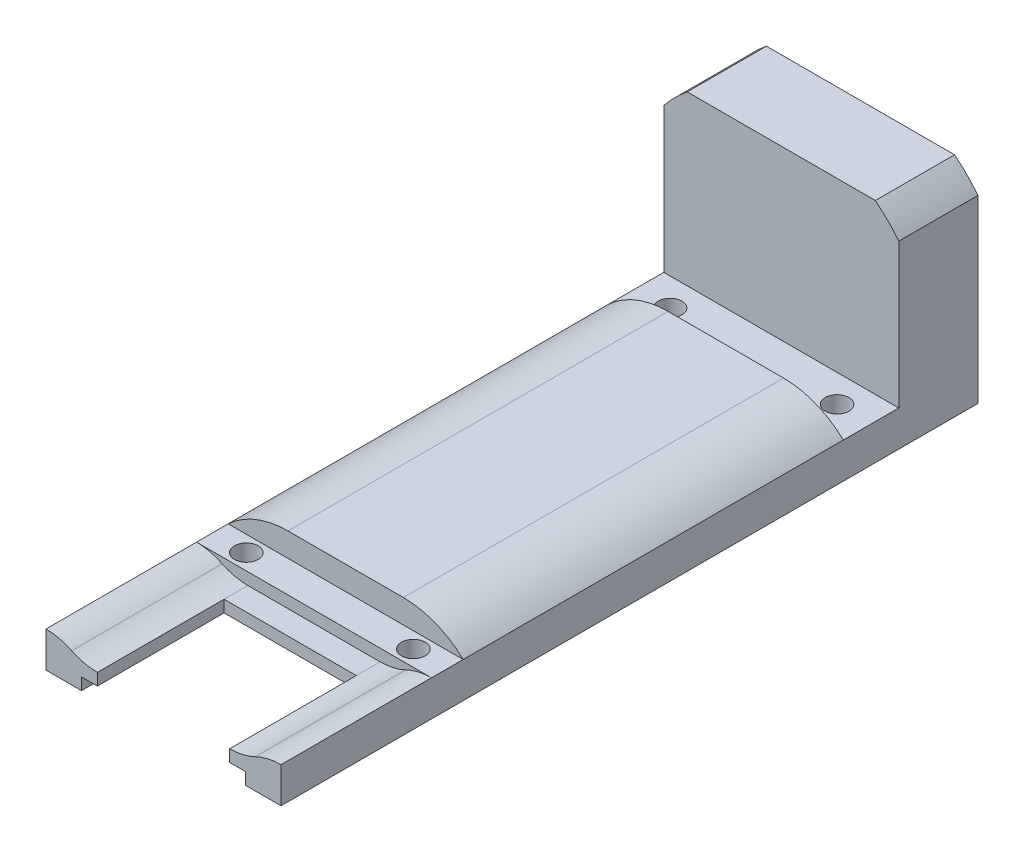
from build123d import *

# Parameters (mm, degrees)
SKETCH1_W               = 6.485
SKETCH1_H               = 4.5
BOSS_EXTRUDE1_DEPTH     = 88
BOSS_EXTRUDE1_2_DEPTH   = 88
SKETCH3_W               = 2
SKETCH3_H               = 1.5
CUT_EXTRUDE2_DEPTH      = 30
SKETCH4_W               = 2
SKETCH4_H               = 4.5
CUT_EXTRUDE3_DEPTH      = 65
BOSS_EXTRUDE2_REACH     = 93.644
SKETCH6_W               = 67
SKETCH6_H               = 3
BOSS_EXTRUDE3_DEPTH     = 5
CUT_EXTRUDE4_DEPTH      = 5
BOSS_EXTRUDE4_DEPTH     = 5
BOSS_EXTRUDE5_START     = 7
BOSS_EXTRUDE5_DEPTH     = 48
BOSS_EXTRUDE6_DEPTH     = 48
FILLET1_R               = 11
SKETCH15_W              = 23.7
SKETCH15_H              = 21.22267295
CUT_EXTRUDE6_DEPTH      = 7
SKETCH16_W              = 16.7
SKETCH16_H              = 1.5
CUT_EXTRUDE7_DEPTH      = 19
CUT_EXTRUDE5_DEPTH      = 92.727000479
CUT_EXTRUDE5_DEPTH_BACK = 92.727000479
SKETCH13_R              = 1.5


with BuildPart() as part:
    # Sketch1 → Boss-Extrude1 (new body)
    with BuildSketch(Plane.XY):
        with Locations((-11.5925, 2.25)):
            Rectangle(SKETCH1_W, SKETCH1_H)
    extrude(amount=-BOSS_EXTRUDE1_DEPTH)


with BuildPart() as body_2:
    # Sketch1 → Boss-Extrude1 2 (new body)
    with BuildSketch(Plane.XY):
        with Locations((11.5925, 2.25)):
            Rectangle(SKETCH1_W, SKETCH1_H)
    extrude(amount=-BOSS_EXTRUDE1_2_DEPTH)


with BuildPart() as cut_extrude2_tool:
    # Sketch3 → Cut-Extrude2 (new body)
    with BuildSketch(Plane.XY):
        with Locations((-9.35, 0.75)):
            Rectangle(SKETCH3_W, SKETCH3_H)
        with Locations((9.35, 0.75)):
            Rectangle(SKETCH3_W, SKETCH3_H)
    extrude(amount=-CUT_EXTRUDE2_DEPTH)


with BuildPart() as part_1:
    add(part.part)

    # Cut-Extrude2: cut by cut_extrude2_tool
    add(cut_extrude2_tool.part, mode=Mode.SUBTRACT)


with BuildPart() as body_2_1:
    add(body_2.part)

    # Cut-Extrude2: cut by cut_extrude2_tool
    add(cut_extrude2_tool.part, mode=Mode.SUBTRACT)


with BuildPart() as cut_extrude3_tool:
    # Sketch4 → Cut-Extrude3 (new body)
    with BuildSketch(Plane(origin=(0, 0, -88), x_dir=(-1, 0, 0), z_dir=(0, 0, -1))):
        with Locations((9.35, 2.25)):
            Rectangle(SKETCH4_W, SKETCH4_H)
        with Locations((-9.35, 2.25)):
            Rectangle(SKETCH4_W, SKETCH4_H)
    extrude(amount=-CUT_EXTRUDE3_DEPTH)


with BuildPart() as part_2:
    add(part_1.part)

    # Cut-Extrude3: cut by cut_extrude3_tool
    add(cut_extrude3_tool.part, mode=Mode.SUBTRACT)


with BuildPart() as body_2_2:
    add(body_2_1.part)

    # Cut-Extrude3: cut by cut_extrude3_tool
    add(cut_extrude3_tool.part, mode=Mode.SUBTRACT)

    # Boss-Extrude2: up to this face of the body (flat: up to its plane)
    boss_extrude2_end = Plane(body_2_2.part.faces().sort_by_distance((10.35, 2.091743119, -50.857798165))[0])
    # Sketch6 → Boss-Extrude2 (add, up to the picked face)
    with BuildSketch(Plane(origin=(-10.35, 0, 0), x_dir=(0, 0, -1), z_dir=(1, 0, 0)), mode=Mode.PRIVATE) as boss_extrude2_sk1:
        with Locations((49.5, 3)):
            Rectangle(SKETCH6_W, SKETCH6_H)
    boss_extrude2_tool1 = split(extrude(boss_extrude2_sk1.sketch, amount=BOSS_EXTRUDE2_REACH, mode=Mode.PRIVATE), bisect_by=boss_extrude2_end, keep=Keep.BOTH, mode=Mode.PRIVATE)

    add(part_2.part)  # Boss-Extrude2 merges part
    add(boss_extrude2_tool1.solids().sort_by(Axis((-10.35, 3, -49.5), (1, 0, 0)))[0])

    # Sketch8 → Boss-Extrude3 (add)
    with BuildSketch(Plane(origin=(0, 0, -88), x_dir=(-1, 0, 0), z_dir=(0, 0, -1))):
        Polygon((-14.835, 25.70767295), (-14.835, 4.5), (-10.35, 4.5), (-10.35, 21.22267295), (10.35, 21.22267295), (10.35, 4.5), (14.835, 4.5), (14.835, 25.70767295), align=None)
    extrude(amount=-BOSS_EXTRUDE3_DEPTH)

    # Sketch9 → Cut-Extrude4 (cut)
    with BuildSketch(Plane(origin=(0, 0, -88), x_dir=(-1, 0, 0), z_dir=(0, 0, -1))):
        with BuildLine():
            Line((-15.009070225, 25.881743175), (-15.009070225, 22.527310239))
            ThreePointArc((-15.009070225, 22.527310239), (-13.436955933, 24.309628883), (-11.654637289, 25.881743175))
            Line((-11.654637289, 25.881743175), (-15.009070225, 25.881743175))
        make_face()
        with BuildLine():
            Line((15.009070225, 25.881743175), (15.009070225, 22.527310239))
            ThreePointArc((15.009070225, 22.527310239), (13.436955933, 24.309628883), (11.654637289, 25.881743175))
            Line((11.654637289, 25.881743175), (15.009070225, 25.881743175))
        make_face()
    extrude(amount=-CUT_EXTRUDE4_DEPTH, mode=Mode.SUBTRACT)

    # Sketch11 → Boss-Extrude4 (add)
    with BuildSketch(Plane.XY.offset(-83)):
        with BuildLine():
            Line((14.835, 4.5), (14.835, 22.748097759))
            ThreePointArc((14.835, 22.748097759), (13.436955933, 24.309628883), (11.875424809, 25.70767295))
            Line((11.875424809, 25.70767295), (-11.875424809, 25.70767295))
            ThreePointArc((-11.875424809, 25.70767295), (-13.436955933, 24.309628883), (-14.835, 22.748097759))
            Line((-14.835, 22.748097759), (-14.835, 4.5))
            Line((-14.835, 4.5), (14.835, 4.5))
        make_face()
    extrude(amount=BOSS_EXTRUDE4_DEPTH)

    # Sketch12 → Boss-Extrude5 (add)
    with BuildSketch(Plane.XY.offset(-78).offset(BOSS_EXTRUDE5_START)):
        Polygon((-14.835, 4.5), (-11.835, 7.5), (11.835, 7.5), (14.835, 4.5), align=None)
    extrude(amount=BOSS_EXTRUDE5_DEPTH)

    # Sketch14 → Boss-Extrude6 (add)
    with BuildSketch(Plane.XY.offset(-23)):
        Polygon((-11.835, 7.5), (-14.835, 4.5), (-10.835, 4.5), (-10.835, 7.5), align=None)
        Polygon((11.835, 7.5), (14.835, 4.5), (10.835, 4.5), (10.835, 7.5), align=None)
    extrude(amount=-BOSS_EXTRUDE6_DEPTH)

    # Fillet1
    # the kernel refuses this fillet: 11 mm, written as the material it takes off along each edge
    with BuildSketch(Plane(origin=(11.835, 7.5, -82.374586088), x_dir=(-1, 0, 0), z_dir=(0, 0, 1))) as fillet1_piece_1_section:
        with BuildLine():
            CenterArc((4.549834435, 11), FILLET1_R, 226.658241773, 43.341758227)
            Line((-3, 3), (0, 0))
            Line((0, 0), (4.549834435, 0))
        make_face()
    fillet1_piece_1 = extrude(amount=70.749172176, mode=Mode.PRIVATE)
    fillet1_piece_1 = split(fillet1_piece_1, bisect_by=Plane(origin=(11.355308805, 6.742969198, -78), z_dir=(0, 0, 1)), keep=Keep.TOP, mode=Mode.PRIVATE)
    add(fillet1_piece_1, mode=Mode.SUBTRACT)
    with BuildSketch(Plane(origin=(-11.835, 7.5, -82.374586088), x_dir=(1, 0, 0), z_dir=(0, 0, 1))) as fillet1_piece_2_section:
        with BuildLine():
            CenterArc((4.549834435, -11), FILLET1_R, 90, 43.341758227)
            Line((-3, -3), (0, 0))
            Line((0, 0), (4.549834435, 0))
        make_face()
    fillet1_piece_2 = extrude(amount=70.749172176, mode=Mode.PRIVATE)
    fillet1_piece_2 = split(fillet1_piece_2, bisect_by=Plane(origin=(-11.355308805, 6.742969198, -78), z_dir=(0, 0, 1)), keep=Keep.TOP, mode=Mode.PRIVATE)
    add(fillet1_piece_2, mode=Mode.SUBTRACT)

    # Sketch15 → Cut-Extrude6 (cut)
    with BuildSketch(Plane(origin=(0, 0, -88), x_dir=(-1, 0, 0), z_dir=(0, 0, -1))):
        with Locations((0, 12.111336475)):
            Rectangle(SKETCH15_W, SKETCH15_H)
    extrude(amount=-CUT_EXTRUDE6_DEPTH, mode=Mode.SUBTRACT)

    # Sketch16 → Cut-Extrude7 (cut)
    with BuildSketch(Plane.XY):
        with BuildLine():
            ThreePointArc((11.5925, 3.75), (10.014054255, 3.189942939), (8.35, 3))
            Line((8.35, 3), (8.35, 4.5))
            Line((8.35, 4.5), (14.835, 4.5))
            ThreePointArc((14.835, 4.5), (13.170945745, 4.310057061), (11.5925, 3.75))
        make_face()
        with BuildLine():
            ThreePointArc((-11.5925, 3.75), (-10.014054255, 3.189942939), (-8.35, 3))
            Line((-8.35, 3), (-8.35, 4.5))
            Line((-8.35, 4.5), (-14.835, 4.5))
            ThreePointArc((-14.835, 4.5), (-13.170945745, 4.310057061), (-11.5925, 3.75))
        make_face()
        with Locations((0, 3.75)):
            Rectangle(SKETCH16_W, SKETCH16_H)
    extrude(amount=-CUT_EXTRUDE7_DEPTH, mode=Mode.SUBTRACT)

    # Sketch13 → Cut-Extrude5 (cut, two sides: drawn at the far end of the back side and taken through both)
    with BuildSketch(Plane(origin=(0, 4.5, 0), x_dir=(1, 0, 0), z_dir=(0, 1, 0)).offset(-CUT_EXTRUDE5_DEPTH_BACK)):
        with Locations(Location((10.542662348, 74.5, 0), (0, 0, 97.379545614))):
            Circle(SKETCH13_R)
        with Locations(Location((-10.542662348, 74.5, 0), (0, 0, 277.379545614))):
            Circle(SKETCH13_R)
        with Locations(Location((10.542662348, 21, 0), (0, 0, 97.379545614))):
            Circle(SKETCH13_R)
        with Locations(Location((-10.542662348, 21, 0), (0, 0, 277.379545614))):
            Circle(SKETCH13_R)
    extrude(amount=CUT_EXTRUDE5_DEPTH + CUT_EXTRUDE5_DEPTH_BACK, mode=Mode.SUBTRACT)


solid = body_2_2.part
